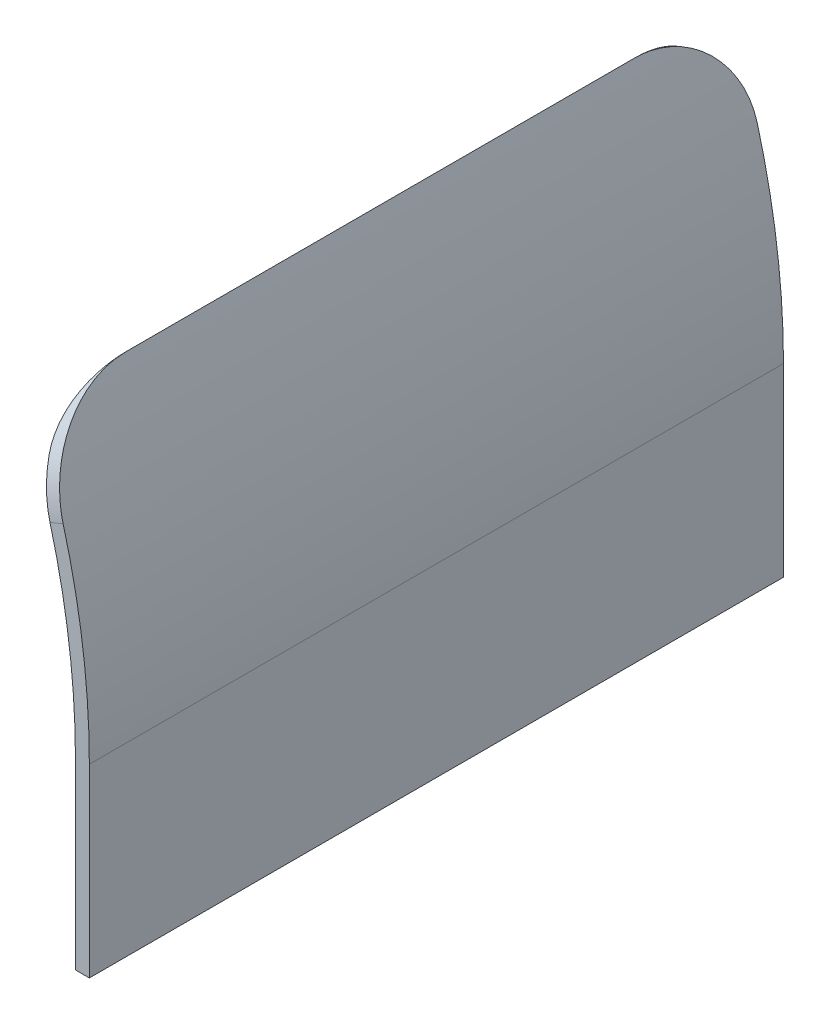
from build123d import *

# Parameters (mm, degrees)
BOSS_EXTRUDE1_DEPTH = 375
FILLET1_R           = 100
FILLET2_R           = 100


with BuildPart() as part:
    # Sketch2 → Boss-Extrude1 (new, symmetric)
    with BuildSketch(Plane.XY):
        with BuildLine():
            Line((0, 0), (0, 197.03652177061554))
            ThreePointArc((0, 197.03652177061554), (-15.037794104979639, 351.42024926941554), (-59.58583829105939, 499.99999999999994))
            Line((-59.58583829105939, 499.99999999999994), (-45.68004275536319, 505.62395328211494))
            ThreePointArc((-45.68004275536319, 505.62395328211494), (-0.31663526116813046, 355.79479163998155), (15, 200))
            Line((15, 200), (15, 0))
            Line((15, 0), (0, 0))
        make_face()
    extrude(amount=BOSS_EXTRUDE1_DEPTH, both=True)

    # Fillet1
    fillet1_edges = [part.edges().sort_by_distance(p)[0] for p in [
        (-52.63294052321129, 502.8119766410574, 375),
        (-52.63294052321129, 502.8119766410574, -375),
    ]]
    fillet(fillet1_edges, radius=FILLET1_R)

    # Fillet2
    # the kernel refuses this fillet: 100 mm, written as the material it takes off along each edge
    with BuildSketch(Plane(origin=(-59.585838291059304, 500, -398.16540938759147), x_dir=(0.35002683735088513, -0.9367396720189324, 0), z_dir=(0, 0, 1))) as fillet2_piece_1:
        with BuildLine():
            CenterArc((52.34529898972619, 99.95258338935764), FILLET2_R, 238.16595036799683, 30.069556200548902)
            Line((-0.40077852073035836, 14.99464493001819), (-1.4557000709394878, 13.295486160831398))
            ThreePointArc((-1.4557000709394878, 13.295486160831398), (-2.1996752510342628, 7.443885328911702), (-1.9992859906690836, -0.05343713609739175))
            Line((-1.9992859906690836, -0.05343713609739175), (0.06158270469381519, -1.9990516677871575))
            ThreePointArc((0.06158270469381519, -1.9990516677871575), (24.633081877518478, -1.6206671148610328), (49.20458105034301, -1.999051667787162))
            Line((49.20458105034301, -1.999051667787162), (49.266163755036786, -3.27e-15))
        make_face()
    extrude(amount=796.3308187751829, mode=Mode.SUBTRACT)


solid = part.part
